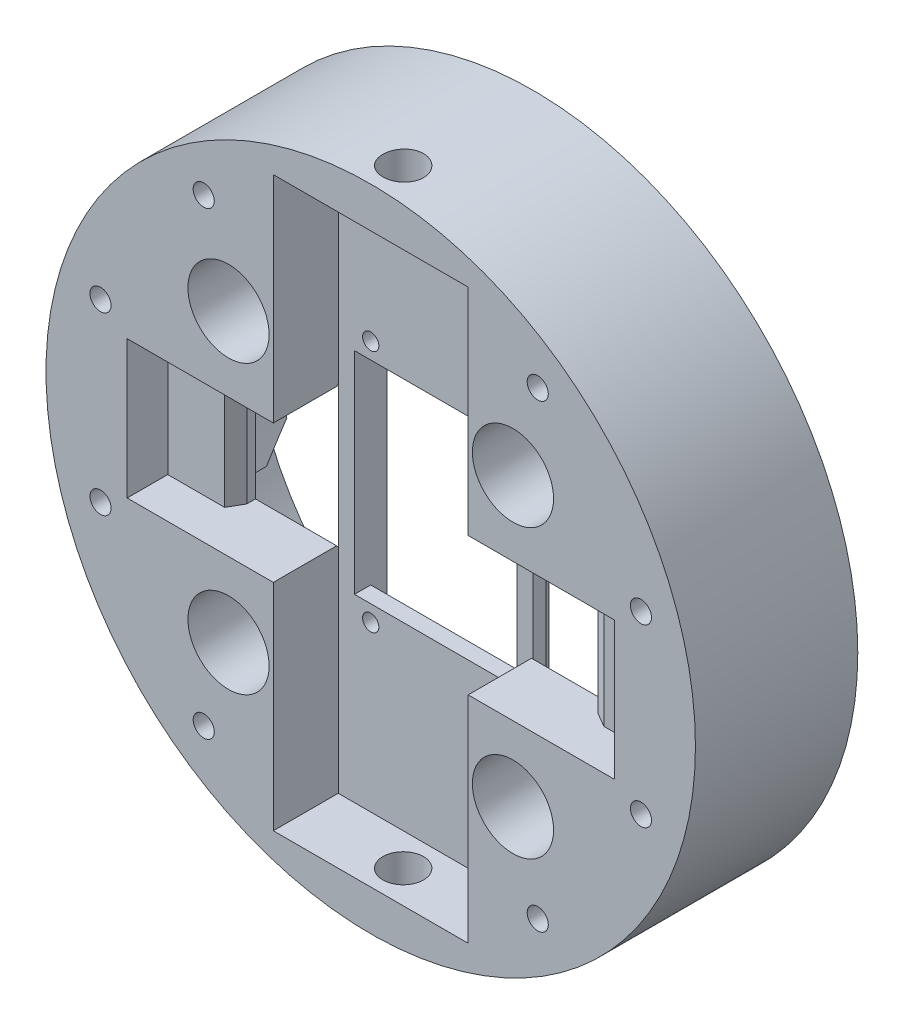
from build123d import *
from OCP.BRepAlgoAPI import BRepAlgoAPI_Cut
from OCP.TopTools import TopTools_ListOfShape
from OCP.BRepFilletAPI import BRepFilletAPI_MakeChamfer

# Parameters (mm, degrees)
SKETCH1_R                = 40
BOSS_EXTRUDE1_DEPTH      = 20
CUT_EXTRUDE1_DEPTH       = 8
CUT_EXTRUDE6_DEPTH       = 5
CUT_EXTRUDE7_DEPTH       = 8
CUT_EXTRUDE9_DEPTH       = 4
SKETCH15_AGAIN_R         = 1.0000000000000018
SKETCH15_AGAIN_R_2       = 1.0000000000000009
CUT_EXTRUDE12_DEPTH      = 2
SKETCH25_R               = 1.2999999999999987
SKETCH25_R_2             = 1.3000000000000014
SKETCH25_R_3             = 1.300000000000001
SKETCH25_R_4             = 1.2999999999999998
SKETCH25_R_5             = 1.3000000000000003
SKETCH25_R_6             = 1.2999999999999994
SKETCH25_R_7             = 1.2999999999999985
CUT_EXTRUDE19_DEPTH      = 7
SKETCH28_R               = 1.0000000000000018
CUT_EXTRUDE20_DEPTH      = 10
CUT_EXTRUDE21_DEPTH      = 7
CHAMFER1_SIZE            = 3
CHAMFER1_SIZE2           = 3.5752607777826437
SKETCH16_R               = 4.999999999999997
SKETCH16_R_2             = 5.000000000000001
SKETCH16_R_3             = 5.0000000000000036
CUT_EXTRUDE22_DEPTH      = 12
CHAMFER2_START           = -27
CHAMFER2_DEPTH           = 15
CHAMFER2_START_2         = 12
CHAMFER2_2_DEPTH         = 15
CHAMFER2_START_3         = -8.72313087
CHAMFER2_3_DEPTH         = 17
CHAMFER2_START_4         = -13.72313087
CHAMFER2_4_DEPTH         = 27
CUT_EXTRUDE23_DEPTH      = 84.00000000000004
CUT_EXTRUDE23_DEPTH_BACK = 90
CHAMFER6_SIZE2           = 2
CHAMFER6_SIZE            = 1.678199262
CHAMFER7_SIZE            = 2.4
CHAMFER7_SIZE_2          = 2.013839115
CHAMFER8_SIZE            = 1
CHAMFER8_SIZE2           = 1.7320508075688867


with BuildPart() as part:
    # Sketch1 → Boss-Extrude1 (new body)
    with BuildSketch(Plane.XY):
        with Locations((0, -0.2231308703956117)):
            Circle(SKETCH1_R)
    extrude(amount=BOSS_EXTRUDE1_DEPTH)

    # Sketch1<3> → Cut-Extrude1 (cut)
    with BuildSketch(Plane.XY):
        with BuildLine():
            Line((32, -14.400577749153458), (29.25714285714285, -13.185368016688496))
            ThreePointArc((29.25714285714285, -13.185368016688496), (32, -0.22313087039560991), (29.25714285714285, 12.739106275897278))
            Line((29.25714285714285, 12.739106275897278), (32, 13.954316008362234))
            ThreePointArc((32, 13.954316008362234), (-5.63e-15, 34.77686912960439), (-32.00000000000001, 13.954316008362225))
            Line((-32.00000000000001, 13.954316008362225), (-29.257142857142856, 12.739106275897262))
            ThreePointArc((-29.257142857142856, 12.739106275897262), (-32, -0.22313087039560778), (-29.257142857142856, -13.185368016688487))
            Line((-29.257142857142856, -13.185368016688487), (-32.00000000000001, -14.400577749153445))
            ThreePointArc((-32.00000000000001, -14.400577749153445), (-5.63e-15, -35.22313087039562), (32, -14.400577749153458))
        make_face()
    extrude(amount=CUT_EXTRUDE1_DEPTH, mode=Mode.SUBTRACT)

    # Sketch8 → Cut-Extrude6 (cut)
    with BuildSketch(Plane.XY.offset(20)):
        Polygon((-29.999999999999993, 8.276869129604389), (29.99999999999994, 8.276869129604389), (29.999999999999943, -8.723130870395606), (-29.999999999999993, -8.723130870395613), align=None)
    extrude(amount=-CUT_EXTRUDE6_DEPTH, mode=Mode.SUBTRACT)

    # Sketch12 → Cut-Extrude7 (cut)
    with BuildSketch(Plane.XY.offset(20)):
        Polygon((12, 34.77686912960441), (-12, 34.7768691296044), (-11.999999999999991, -35.22313087039561), (12.000000000000034, -35.2231308703956), align=None)
    extrude(amount=-CUT_EXTRUDE7_DEPTH, mode=Mode.SUBTRACT)

    # Sketch15 → Cut-Extrude9 (cut)
    with BuildSketch(Plane.XY.offset(8)):
        Polygon((9.999999999999973, 13.000004746174419), (-10.000000000000009, 13.000004746174419), (-10.000000000000016, -12.999995253825592), (9.99999999999998, -12.999995253825592), align=None)
    extrude(amount=CUT_EXTRUDE9_DEPTH, mode=Mode.SUBTRACT)

    # Sketch15 again → Cut-Extrude12 (cut)
    # profile 1 of 4: a face of its own
    with BuildSketch(Plane.XY.offset(8)):
        Polygon((9.999999999999982, 13.000004746174419), (9.999999999999982, 17.00000474617441), (-1.776e-14, 17.00000474617441), (-1.735e-14, 13.000004746174419), align=None)
        with Locations((7.999999999999976, 15.000004746174419)):
            Circle(SKETCH15_AGAIN_R, mode=Mode.SUBTRACT)
    # profile 2 of 4: a face of its own
    with BuildSketch(Plane.XY.offset(8)):
        Polygon((-1.735e-14, 13.000004746174419), (-1.735e-14, 17.00000474617442), (-10.000000000000018, 17.000004746174415), (-10.00000000000002, 13.000004746174419), align=None)
        with Locations((-8.00000000000001, 15.000004746174419)):
            Circle(SKETCH15_AGAIN_R_2, mode=Mode.SUBTRACT)
    # profile 3 of 4: a face of its own
    with BuildSketch(Plane.XY.offset(8)):
        Polygon((9.999999999999982, -16.99999525382559), (9.999999999999982, -12.999995253825592), (-8.88e-15, -12.999995253825592), (-1.735e-14, -16.99999525382559), align=None)
        with Locations((7.999999999999976, -14.999995253825588)):
            Circle(SKETCH15_AGAIN_R, mode=Mode.SUBTRACT)
    # profile 4 of 4: a face of its own
    with BuildSketch(Plane.XY.offset(8)):
        Polygon((-1.735e-14, -16.99999525382559), (-1.735e-14, -12.999995253825592), (-10.000000000000016, -12.999995253825592), (-10.000000000000018, -16.999995253825585), align=None)
        with Locations((-8.00000000000001, -14.999995253825588)):
            Circle(SKETCH15_AGAIN_R_2, mode=Mode.SUBTRACT)
    extrude(amount=CUT_EXTRUDE12_DEPTH, mode=Mode.SUBTRACT)

    # Sketch25 → Cut-Extrude19 (cut)
    with BuildSketch(Plane.XY.offset(20)):
        with Locations((20.572483830236603, 28.31559480312315)):
            Circle(SKETCH25_R)
        with Locations((33.286978070330434, 10.815594803123071)):
            Circle(SKETCH25_R_2)
        with Locations((33.286978070330356, -10.815594803123314)):
            Circle(SKETCH25_R_3)
        with Locations((20.572483830236415, -28.315594803123286)):
            Circle(SKETCH25_R_4)
        with Locations((-20.572483830236816, -28.315594803122988)):
            Circle(SKETCH25_R)
        with Locations((-33.286978070330484, -10.815594803122844)):
            Circle(SKETCH25_R_5)
        with Locations((-33.28697807033027, 10.815594803123542)):
            Circle(SKETCH25_R_6)
        with Locations((-20.57248383023619, 28.31559480312344)):
            Circle(SKETCH25_R_7)
    extrude(amount=-CUT_EXTRUDE19_DEPTH, mode=Mode.SUBTRACT)


with BuildPart() as cut_extrude20_tool:
    # Sketch28 → Cut-Extrude20 (new body)
    with BuildSketch(Plane(origin=(0, 0, 8), x_dir=(-1, 0, 0), z_dir=(0, 0, -1))):
        with Locations(Location((-7.999999999999976, -14.999995253825588, 0), (0, 0, 180))):
            Circle(SKETCH28_R)
        with Locations(Location((8.00000000000001, -14.999995253825588, 0), (0, 0, 180))):
            Circle(SKETCH28_R)
        with Locations(Location((-7.999999999999976, 15.000004746174419, 0), (0, 0, 180))):
            Circle(SKETCH28_R)
        with Locations(Location((8.00000000000001, 15.000000000000007, 0), (0, 0, 180))):
            Circle(SKETCH28_R)
    extrude(amount=-CUT_EXTRUDE20_DEPTH)


with BuildPart() as part_1:
    add(part.part)

    # Cut-Extrude20: cut by cut_extrude20_tool, with a tolerance
    cut_extrude20_stock = TopTools_ListOfShape()
    cut_extrude20_stock.Append(part_1.part.wrapped)
    cut_extrude20_tools = TopTools_ListOfShape()
    cut_extrude20_tools.Append(cut_extrude20_tool.part.wrapped)
    cut_extrude20_cut = BRepAlgoAPI_Cut()
    cut_extrude20_cut.SetArguments(cut_extrude20_stock)
    cut_extrude20_cut.SetTools(cut_extrude20_tools)
    cut_extrude20_cut.SetFuzzyValue(0.00001)
    cut_extrude20_cut.Build()
    add(Compound.cast(cut_extrude20_cut.Shape()).solids(), mode=Mode.REPLACE)

    # Sketch30 → Cut-Extrude21 (cut)
    with BuildSketch(Plane.XY.offset(8)):
        Polygon((-21.999999999999996, -0.22313087039560822), (-11.999999999999993, -0.22313087039560822), (-11.999999999999995, 8.276869129604389), (-21.999999999999996, 8.27686912960439), align=None)
        Polygon((-11.999999999999993, -8.723130870395611), (-11.999999999999995, -0.22313087039560742), (-21.999999999999996, -0.22313087039560822), (-21.999999999999993, -8.72313087039561), align=None)
        Polygon((22.000000000000007, -0.22313087039560822), (12.000000000000007, -0.22313087039560822), (12.000000000000004, -8.723130870395607), (22.000000000000007, -8.723130870395606), align=None)
        Polygon((12.000000000000002, 8.276869129604393), (12.000000000000004, -0.22313087039560742), (22.000000000000007, -0.22313087039560822), (22.000000000000004, 8.276869129604396), align=None)
    extrude(amount=CUT_EXTRUDE21_DEPTH, mode=Mode.SUBTRACT)

    # Chamfer1: one chamfer whose edges measure the first distance from different faces: ONE call of the kernel's chamfer builder (chamfer() names one face for all edges)
    chamfer1_edges_1 = [part_1.edges().sort_by_distance(p)[0] for p in [
        (30.628571428571426, -13.792972882920978, 0),
    ]]
    chamfer1_side_1 = [part_1.faces().sort_by_distance(p)[0] for p in [
        (30.62857142857142, -13.792972882920976, 4),
    ]]
    chamfer1_edges_2 = [part_1.edges().sort_by_distance(p)[0] for p in [
        (30.628571428571426, 13.346711142129756, 0),
        (-30.628571428571433, -13.792972882920967, 0),
    ]]
    chamfer1_side_2 = [part_1.faces().sort_by_distance(p)[0] for p in [
        (-38.868629150101526, -0.22313087039560695, 0),
    ]]
    chamfer1_edges_3 = [part_1.edges().sort_by_distance(p)[0] for p in [
        (-30.628571428571433, 13.346711142129744, 0),
    ]]
    chamfer1_side_3 = [part_1.faces().sort_by_distance(p)[0] for p in [
        (-30.628571428571433, 13.346711142129744, 4),
    ]]
    chamfer1 = BRepFilletAPI_MakeChamfer(part_1.part.solid().wrapped)
    for e in chamfer1_edges_1:
        chamfer1.Add(CHAMFER1_SIZE, CHAMFER1_SIZE2, e.wrapped, chamfer1_side_1[0].wrapped)  # the first distance lies on this face
    for e in chamfer1_edges_2:
        chamfer1.Add(CHAMFER1_SIZE, CHAMFER1_SIZE2, e.wrapped, chamfer1_side_2[0].wrapped)  # the first distance lies on this face
    for e in chamfer1_edges_3:
        chamfer1.Add(CHAMFER1_SIZE, CHAMFER1_SIZE2, e.wrapped, chamfer1_side_3[0].wrapped)  # the first distance lies on this face
    add(Compound.cast(chamfer1.Shape()), mode=Mode.REPLACE)

    # Sketch16 → Cut-Extrude22 (cut)
    with BuildSketch(Plane.XY.offset(20)):
        with Locations((17.51989217811493, 17.45686912960439)):
            Circle(SKETCH16_R)
        with Locations((17.519892178114794, -17.903130870395614)):
            Circle(SKETCH16_R_2)
        with Locations((-17.519892178115043, -17.903130870395614)):
            Circle(SKETCH16_R_2)
        with Locations((-17.519892178114677, 17.45686912960439)):
            Circle(SKETCH16_R_3)
    extrude(amount=-CUT_EXTRUDE22_DEPTH, mode=Mode.SUBTRACT)

    # Chamfer2: read off the stored shape, not the designer's step
    # Chamfer2 outline → Chamfer2 (cut)
    with BuildSketch(Plane.YZ.offset(CHAMFER2_START)):
        Polygon((8.27686913, 12.195498156), (8.27686913, 8), (13.27686913, 8), align=None)
        Polygon((-8.72313087, 12.195498156), (-13.72313087, 8), (-8.72313087, 8), align=None)
    extrude(amount=CHAMFER2_DEPTH, mode=Mode.SUBTRACT)

    # Chamfer2 2 outline → Chamfer2 2 (cut)
    with BuildSketch(Plane.YZ.offset(CHAMFER2_START_2)):
        Polygon((8.27686913, 12.195498156), (8.27686913, 8), (13.27686913, 8), align=None)
        Polygon((-8.72313087, 12.195498156), (-13.72313087, 8), (-8.72313087, 8), align=None)
    extrude(amount=CHAMFER2_2_DEPTH, mode=Mode.SUBTRACT)

    # Chamfer2 3 outline → Chamfer2 3 (cut)
    with BuildSketch(Plane(origin=(0, 0, 0), x_dir=(1, 0, 0), z_dir=(0, 1, 0)).offset(CHAMFER2_START_3)):
        Polygon((22, -8), (22, -12.195498156), (27, -8), align=None)
        Polygon((-22, -12.195498156), (-22, -8), (-27, -8), align=None)
    extrude(amount=CHAMFER2_3_DEPTH, mode=Mode.SUBTRACT)

    # Chamfer2 4 outline → Chamfer2 4 (add)
    with BuildSketch(Plane(origin=(0, 0, 0), x_dir=(1, 0, 0), z_dir=(0, 1, 0)).offset(CHAMFER2_START_4)):
        Polygon((27, -8), (22, -12.195498156), (22, -14), (29, -14), (29, -8), align=None)
        Polygon((-22, -12.195498156), (-27, -8), (-29, -8), (-29, -14), (-22, -14), align=None)
    extrude(amount=CHAMFER2_4_DEPTH)

    # Sketch31 → Cut-Extrude23 (cut, two sides: drawn at the far end of the back side and taken through both)
    with BuildSketch(Plane(origin=(1.018e-14, -35.22313087039561, 0), x_dir=(1, 2.9e-16, 0), z_dir=(-2.9e-16, 1, 0)).offset(-CUT_EXTRUDE23_DEPTH_BACK)):
        with BuildLine():
            ThreePointArc((-1.1e-15, -13.5), (-1.7677669529663624, -14.232233047033635), (-2.4999999999999902, -16))
            Line((-2.499999999999991, -16), (1.066e-14, -16))
            Line((1.041e-14, -16), (1.041e-14, -13.5))
        make_face()
        with BuildLine():
            Line((1.066e-14, -16), (-2.499999999999991, -16))
            ThreePointArc((-2.4999999999999902, -16), (-1.7677669529663638, -17.767766952966365), (-3.37e-15, -18.5))
            Line((1.041e-14, -18.5), (1.041e-14, -16))
        make_face()
        with BuildLine():
            Line((1.041e-14, -13.5), (1.041e-14, -16))
            Line((1.066e-14, -16), (2.5000000000000107, -16))
            ThreePointArc((2.5000000000000107, -16), (1.7677669529663755, -14.232233047033628), (-1.1e-15, -13.5))
        make_face()
        with BuildLine():
            Line((2.5000000000000107, -16), (1.066e-14, -16))
            Line((1.041e-14, -16), (1.041e-14, -18.5))
            ThreePointArc((-3.37e-15, -18.5), (1.7677669529663744, -17.767766952966376), (2.5000000000000107, -16))
        make_face()
        with BuildLine():
            ThreePointArc((-1.1e-15, -13.5), (-1.7677669529663624, -14.232233047033635), (-2.4999999999999902, -16))
            Line((-2.499999999999991, -16), (1.066e-14, -16))
            Line((1.041e-14, -16), (1.041e-14, -13.5))
        make_face()
        with BuildLine():
            Line((1.066e-14, -16), (-2.499999999999991, -16))
            ThreePointArc((-2.4999999999999902, -16), (-1.7677669529663638, -17.767766952966365), (-3.37e-15, -18.5))
            Line((1.041e-14, -18.5), (1.041e-14, -16))
        make_face()
        with BuildLine():
            Line((1.041e-14, -13.5), (1.041e-14, -16))
            Line((1.066e-14, -16), (2.5000000000000107, -16))
            ThreePointArc((2.5000000000000107, -16), (1.7677669529663755, -14.232233047033628), (-1.1e-15, -13.5))
        make_face()
        with BuildLine():
            Line((2.5000000000000107, -16), (1.066e-14, -16))
            Line((1.041e-14, -16), (1.041e-14, -18.5))
            ThreePointArc((-3.37e-15, -18.5), (1.7677669529663744, -17.767766952966376), (2.5000000000000107, -16))
        make_face()
        with BuildLine():
            ThreePointArc((-1.1e-15, -13.5), (-1.7677669529663624, -14.232233047033635), (-2.4999999999999902, -16))
            Line((-2.499999999999991, -16), (1.066e-14, -16))
            Line((1.041e-14, -16), (1.041e-14, -13.5))
        make_face()
        with BuildLine():
            Line((1.066e-14, -16), (-2.499999999999991, -16))
            ThreePointArc((-2.4999999999999902, -16), (-1.7677669529663638, -17.767766952966365), (-3.37e-15, -18.5))
            Line((1.041e-14, -18.5), (1.041e-14, -16))
        make_face()
        with BuildLine():
            Line((1.041e-14, -13.5), (1.041e-14, -16))
            Line((1.066e-14, -16), (2.5000000000000107, -16))
            ThreePointArc((2.5000000000000107, -16), (1.7677669529663755, -14.232233047033628), (-1.1e-15, -13.5))
        make_face()
        with BuildLine():
            Line((2.5000000000000107, -16), (1.066e-14, -16))
            Line((1.041e-14, -16), (1.041e-14, -18.5))
            ThreePointArc((-3.37e-15, -18.5), (1.7677669529663744, -17.767766952966376), (2.5000000000000107, -16))
        make_face()
        with BuildLine():
            ThreePointArc((-1.1e-15, -13.5), (-1.7677669529663624, -14.232233047033635), (-2.4999999999999902, -16))
            Line((-2.499999999999991, -16), (1.066e-14, -16))
            Line((1.041e-14, -16), (1.041e-14, -13.5))
        make_face()
        with BuildLine():
            Line((1.066e-14, -16), (-2.499999999999991, -16))
            ThreePointArc((-2.4999999999999902, -16), (-1.7677669529663638, -17.767766952966365), (-3.37e-15, -18.5))
            Line((1.041e-14, -18.5), (1.041e-14, -16))
        make_face()
        with BuildLine():
            Line((1.041e-14, -13.5), (1.041e-14, -16))
            Line((1.066e-14, -16), (2.5000000000000107, -16))
            ThreePointArc((2.5000000000000107, -16), (1.7677669529663755, -14.232233047033628), (-1.1e-15, -13.5))
        make_face()
        with BuildLine():
            Line((2.5000000000000107, -16), (1.066e-14, -16))
            Line((1.041e-14, -16), (1.041e-14, -18.5))
            ThreePointArc((-3.37e-15, -18.5), (1.7677669529663744, -17.767766952966376), (2.5000000000000107, -16))
        make_face()
    extrude(amount=CUT_EXTRUDE23_DEPTH + CUT_EXTRUDE23_DEPTH_BACK, mode=Mode.SUBTRACT)

    # Chamfer6
    chamfer6_edges = [part_1.edges().sort_by_distance(p)[0] for p in [
        (-12, -0.22313087000000031, 8),
    ]]
    chamfer6_side = [part_1.faces().sort_by_distance(p)[0] for p in [
        (-12, -0.22313087000000031, 8.033563985247092),
    ]]
    chamfer(chamfer6_edges, length=CHAMFER6_SIZE - 0.0001, length2=CHAMFER6_SIZE2 - 0.0001, reference=chamfer6_side[0])  # a hair under: the kernel refuses the full size

    # Chamfer7
    # the kernel refuses this chamfer: 2.4, 2.013839115 mm, written as the material it takes off along each edge
    with BuildSketch(Plane(origin=(12, 19.462643778027733, 8), x_dir=(0, 0, 1), z_dir=(0, -1, 0))) as chamfer7_piece_1_section:
        Polygon((CHAMFER7_SIZE, 0), (0, CHAMFER7_SIZE_2), (0, 0), align=None)
    chamfer7_piece_1 = extrude(amount=39.37154929605547, mode=Mode.PRIVATE)
    chamfer7_piece_1 = split(chamfer7_piece_1, bisect_by=Plane(origin=(12, 5.751081099625855, 24.340804081623677), z_dir=(0, 0.6427876096967526, -0.7660444431104081)), keep=Keep.TOP, mode=Mode.PRIVATE)
    chamfer7_piece_1 = split(chamfer7_piece_1, bisect_by=Plane(origin=(12, 16.906830701476803, 4.9541005841036405), z_dir=(0, -0.6427876096967526, -0.7660444431104081)), keep=Keep.TOP, mode=Mode.PRIVATE)
    add(chamfer7_piece_1, mode=Mode.SUBTRACT)

    # Chamfer8: one chamfer whose edges measure the first distance from different faces: ONE call of the kernel's chamfer builder (chamfer() names one face for all edges)
    chamfer8_edges_1 = [part_1.edges().sort_by_distance(p)[0] for p in [
        (-21.999999999999993, -0.2231308703956092, 15),
    ]]
    chamfer8_side_1 = [part_1.faces().sort_by_distance(p)[0] for p in [
        (-25.999999999999993, -0.22313087039561413, 15),
    ]]
    chamfer8_edges_2 = [part_1.edges().sort_by_distance(p)[0] for p in [
        (22.000000000000007, -0.22313087039560386, 15),
    ]]
    chamfer8_side_2 = [part_1.faces().sort_by_distance(p)[0] for p in [
        (22.000000000000007, -0.22313087029670353, 13.597749078),
    ]]
    chamfer8 = BRepFilletAPI_MakeChamfer(part_1.part.solid().wrapped)
    for e in chamfer8_edges_1:
        chamfer8.Add(CHAMFER8_SIZE, CHAMFER8_SIZE2, e.wrapped, chamfer8_side_1[0].wrapped)  # the first distance lies on this face
    for e in chamfer8_edges_2:
        chamfer8.Add(CHAMFER8_SIZE, CHAMFER8_SIZE2, e.wrapped, chamfer8_side_2[0].wrapped)  # the first distance lies on this face
    add(Compound.cast(chamfer8.Shape()), mode=Mode.REPLACE)


solid = part_1.part
